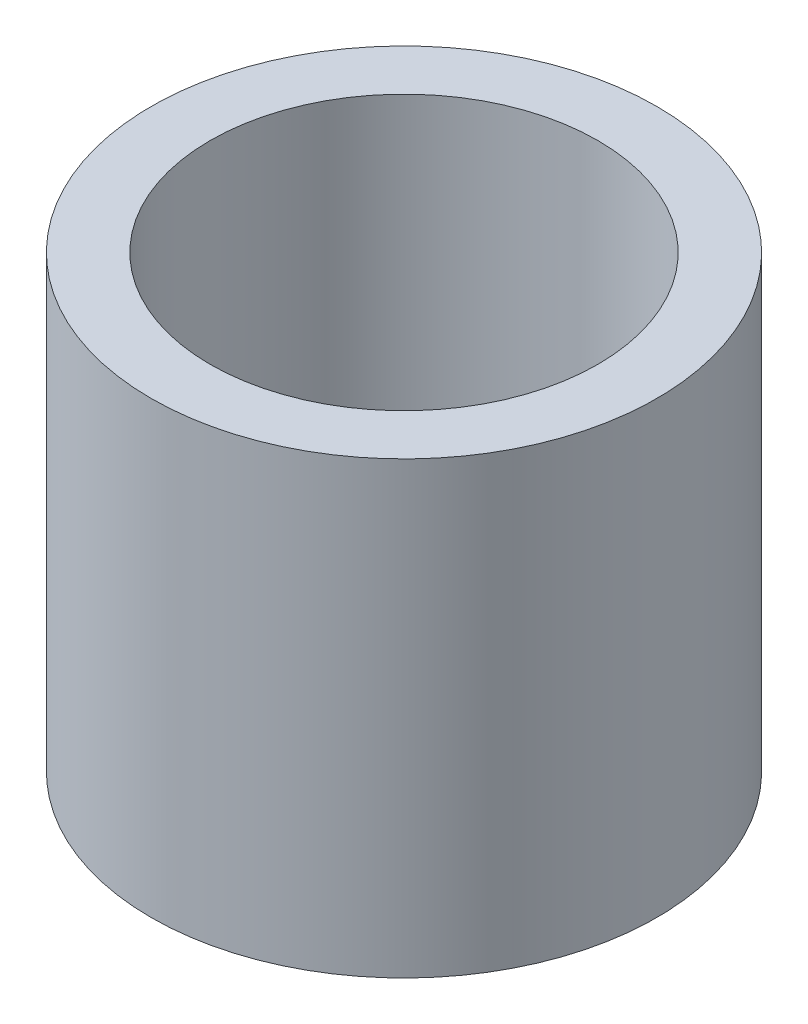
from build123d import *

# Parameters (mm, degrees)
SKETCH1_R           = 9
SKETCH1_R_2         = 6.9
BOSS_EXTRUDE1_DEPTH = 16


with BuildPart() as part:
    # Sketch1 → Boss-Extrude1 (new body)
    with BuildSketch(Plane(origin=(0, 0, 0), x_dir=(1, 0, 0), z_dir=(0, 1, 0))):
        Circle(SKETCH1_R)
        Circle(SKETCH1_R_2, mode=Mode.SUBTRACT)
    extrude(amount=BOSS_EXTRUDE1_DEPTH)


solid = part.part
